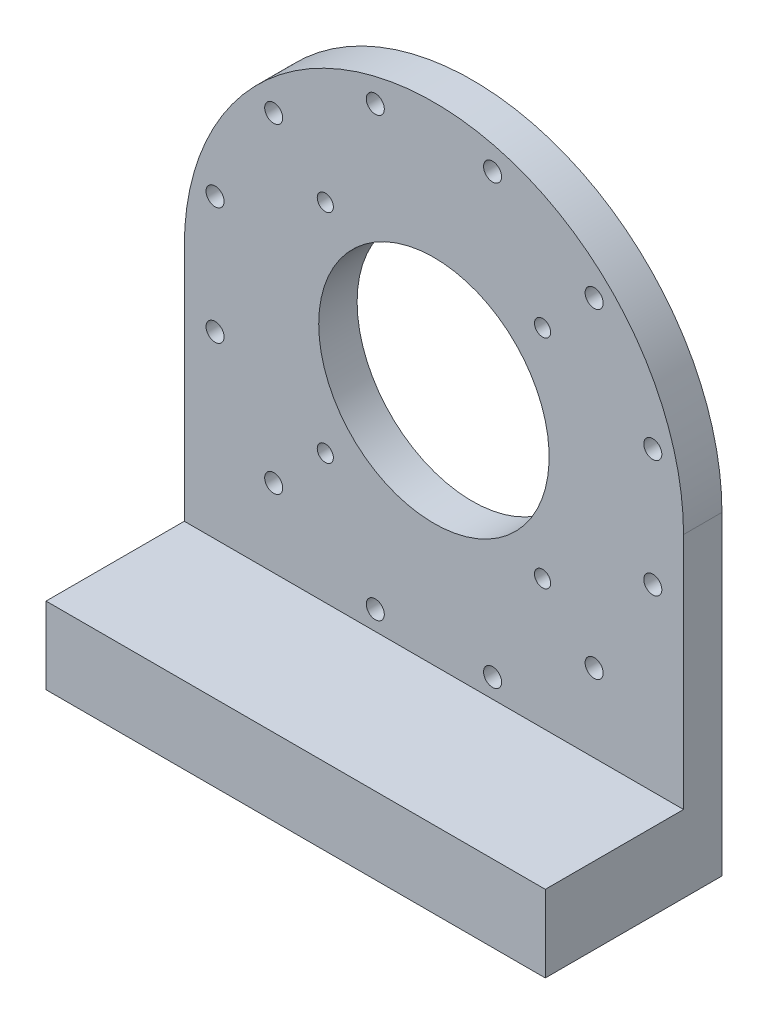
from build123d import *

# Parameters (mm, degrees)
SKETCH1_R           = 1.575
SKETCH1_R_2         = 2.1
SKETCH1_R_3         = 15
BOSS_EXTRUDE1_DEPTH = 10
SKETCH1_3_W         = 130
SKETCH1_3_H         = 20
BOSS_EXTRUDE2_DEPTH = 36
SKETCH2_R           = 30
CUT_EXTRUDE1_DEPTH  = 36
SKETCH4_R           = 2.35
CUT_EXTRUDE2_DEPTH  = 197.103143987


with BuildPart() as part:
    # Sketch1 → Boss-Extrude1 (new body)
    with BuildSketch(Plane(origin=(0, 0, -97.507071393), x_dir=(-1, 0, 0), z_dir=(0, 0, -1))):
        with BuildLine():
            ThreePointArc((-24.072792821, 47.25870832), (-89.072792821, 112.25870832), (-154.072792821, 47.25870832))
            Line((-154.072792821, 47.25870832), (-154.072792821, -34.74129168))
            Line((-154.072792821, -34.74129168), (-24.072792821, -34.74129168))
            Line((-24.072792821, -34.74129168), (-24.072792821, 47.25870832))
        make_face()
        with Locations((-32.08316907, 62.529031982)):
            Circle(SKETCH1_R, mode=Mode.SUBTRACT)
        with Locations((-60.788521574, 75.542979568)):
            Circle(SKETCH1_R_2, mode=Mode.SUBTRACT)
        with Locations((-73.80246916, 104.248332072)):
            Circle(SKETCH1_R, mode=Mode.SUBTRACT)
        with Locations((-47.353492731, 88.978008411)):
            Circle(SKETCH1_R, mode=Mode.SUBTRACT)
        with Locations((-104.343116482, -9.730915431)):
            Circle(SKETCH1_R, mode=Mode.SUBTRACT)
        with Locations((-130.792092911, 5.53940823)):
            Circle(SKETCH1_R, mode=Mode.SUBTRACT)
        with Locations((-146.062416572, 31.988384659)):
            Circle(SKETCH1_R, mode=Mode.SUBTRACT)
        with Locations((-117.357064069, 18.974437073)):
            Circle(SKETCH1_R_2, mode=Mode.SUBTRACT)
        with Locations((-73.80246916, -9.730915431)):
            Circle(SKETCH1_R, mode=Mode.SUBTRACT)
        with Locations((-60.788521574, 18.974437073)):
            Circle(SKETCH1_R_2, mode=Mode.SUBTRACT)
        with Locations((-47.353492731, 5.53940823)):
            Circle(SKETCH1_R, mode=Mode.SUBTRACT)
        with Locations((-32.08316907, 31.988384659)):
            Circle(SKETCH1_R, mode=Mode.SUBTRACT)
        with Locations((-146.062416572, 62.529031982)):
            Circle(SKETCH1_R, mode=Mode.SUBTRACT)
        with Locations((-89.072792821, 47.25870832)):
            Circle(SKETCH1_R_3, mode=Mode.SUBTRACT)
        with Locations((-130.792092911, 88.978008411)):
            Circle(SKETCH1_R, mode=Mode.SUBTRACT)
        with Locations((-117.357064069, 75.542979568)):
            Circle(SKETCH1_R_2, mode=Mode.SUBTRACT)
        with Locations((-104.343116482, 104.248332072)):
            Circle(SKETCH1_R, mode=Mode.SUBTRACT)
    extrude(amount=BOSS_EXTRUDE1_DEPTH)

    # Sketch1<3> → Boss-Extrude2 (add)
    with BuildSketch(Plane(origin=(0, 0, -97.507071393), x_dir=(-1, 0, 0), z_dir=(0, 0, -1))):
        with Locations((-89.072792821, -24.74129168)):
            Rectangle(SKETCH1_3_W, SKETCH1_3_H)
    extrude(amount=-BOSS_EXTRUDE2_DEPTH)

    # Sketch2 → Cut-Extrude1 (cut)
    with BuildSketch(Plane(origin=(0, 0, -107.507071393), x_dir=(-1, 0, 0), z_dir=(0, 0, -1))):
        with Locations((-89.072792821, 47.25870832)):
            Circle(SKETCH2_R)
    extrude(amount=-CUT_EXTRUDE1_DEPTH, mode=Mode.SUBTRACT)

    # Sketch4 → Cut-Extrude2 (cut, through all)
    with BuildSketch(Plane(origin=(0, 0, -107.507071393), x_dir=(-1, 0, 0), z_dir=(0, 0, -1))):
        with Locations((-73.80246916, 104.248332072)):
            Circle(SKETCH4_R)
        with Locations((-47.353492731, 88.978008411)):
            Circle(SKETCH4_R)
        with Locations((-32.08316907, 62.529031982)):
            Circle(SKETCH4_R)
        with Locations((-32.08316907, 31.988384659)):
            Circle(SKETCH4_R)
        with Locations((-47.353492731, 5.53940823)):
            Circle(SKETCH4_R)
        with Locations((-73.80246916, -9.730915431)):
            Circle(SKETCH4_R)
        with Locations((-104.343116482, -9.730915431)):
            Circle(SKETCH4_R)
        with Locations((-130.792092911, 5.53940823)):
            Circle(SKETCH4_R)
        with Locations((-146.062416572, 31.988384659)):
            Circle(SKETCH4_R)
        with Locations((-146.062416572, 62.529031982)):
            Circle(SKETCH4_R)
        with Locations((-130.792092911, 88.978008411)):
            Circle(SKETCH4_R)
        with Locations((-104.343116482, 104.248332072)):
            Circle(SKETCH4_R)
    extrude(amount=-CUT_EXTRUDE2_DEPTH, mode=Mode.SUBTRACT)


solid = part.part
